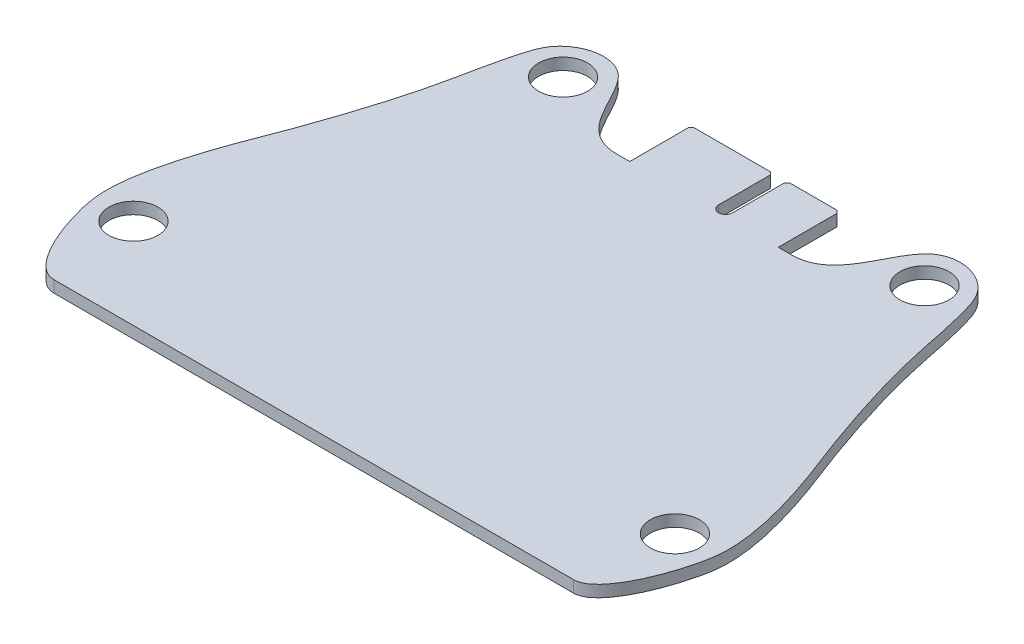
from build123d import *

# Parameters (mm, degrees)
BOSS_EXTRUDE1_DEPTH      = 0.8
BOSS_EXTRUDE1_DEPTH_BACK = 0.8
SKETCH1_R                = 3.35


with BuildPart() as part:
    # Sketch1 → Boss-Extrude1 (new, two sides: drawn at the far end of the back side and taken through both)
    with BuildSketch(Plane(origin=(-28.757656934, 0, -23.069119009), x_dir=(1, 0, 0), z_dir=(0, 1, 0)).offset(-BOSS_EXTRUDE1_DEPTH_BACK)):
        with BuildLine():
            add(Edge.make_bspline(
                [(16.817483134, 5.190880991), (10.987472329, 5.190880991), (9.904380895, 18.143977993), (-0.009114116, 15.469873899), (-2.526134819, 7.788717663), (-3.480546461, 0.197815791), (-7.786124864, -12.673904071), (-10.229427346, -18.843246989), (-14.733793676, -31.011405964), (-12.352543037, -42.371198541), (-9.297057964, -48.139119009), (-6.763242532, -48.139119009)],
                knots=[0, 0, 0, 0, 0.162529727, 0.293884615, 0.32593632, 0.483046776, 0.646953909, 0.682356014, 0.819877627, 0.853361046, 1, 1, 1, 1], degree=3))
            Line((-6.763242532, -48.139119009), (64.278556399, -48.139119009))
            add(Edge.make_bspline(
                [(40.697830733, 5.190880991), (46.527841538, 5.190880991), (47.610932972, 18.143977993), (57.524427984, 15.469873899), (60.041448686, 7.788717663), (60.995860328, 0.197815791), (65.301438731, -12.673904071), (67.744741213, -18.843246989), (72.249107544, -31.011405964), (69.867856905, -42.371198541), (66.812371832, -48.139119009), (64.278556399, -48.139119009)],
                knots=[0, 0, 0, 0, 0.162529727, 0.293884615, 0.32593632, 0.483046776, 0.646953909, 0.682356014, 0.819877627, 0.853361046, 1, 1, 1, 1], degree=3))
            Line((40.697830733, 5.190880991), (38.907656934, 5.190880991))
            Line((38.907656934, 5.190880991), (38.907656934, 13.2373276))
            Line((38.907656934, 13.2373276), (38.554103543, 13.590880991))
            Line((38.554103543, 13.590880991), (32.061210324, 13.590880991))
            Line((32.061210324, 13.590880991), (31.707656934, 13.2373276))
            Line((31.707656934, 13.2373276), (31.707656934, 6.131715151))
            ThreePointArc((31.707656934, 6.131715151), (30.757656934, 5.190880991), (29.807656934, 6.131715151))
            Line((29.807656934, 6.131715151), (29.807656934, 13.2373276))
            Line((29.807656934, 13.2373276), (29.454103543, 13.590880991))
            Line((29.454103543, 13.590880991), (18.961210324, 13.590880991))
            Line((18.961210324, 13.590880991), (18.607656934, 13.2373276))
            Line((18.607656934, 13.2373276), (18.607656934, 5.190880991))
            Line((18.607656934, 5.190880991), (16.817483134, 5.190880991))
        make_face()
        with Locations((-8.242343066, -35.789119009)):
            Circle(SKETCH1_R, mode=Mode.SUBTRACT)
        with Locations((65.757656934, -35.789119009)):
            Circle(SKETCH1_R, mode=Mode.SUBTRACT)
        with Locations((4.057656934, 10.630880991)):
            Circle(SKETCH1_R, mode=Mode.SUBTRACT)
        with Locations((53.457656934, 10.630880991)):
            Circle(SKETCH1_R, mode=Mode.SUBTRACT)
    extrude(amount=BOSS_EXTRUDE1_DEPTH + BOSS_EXTRUDE1_DEPTH_BACK)


solid = part.part
